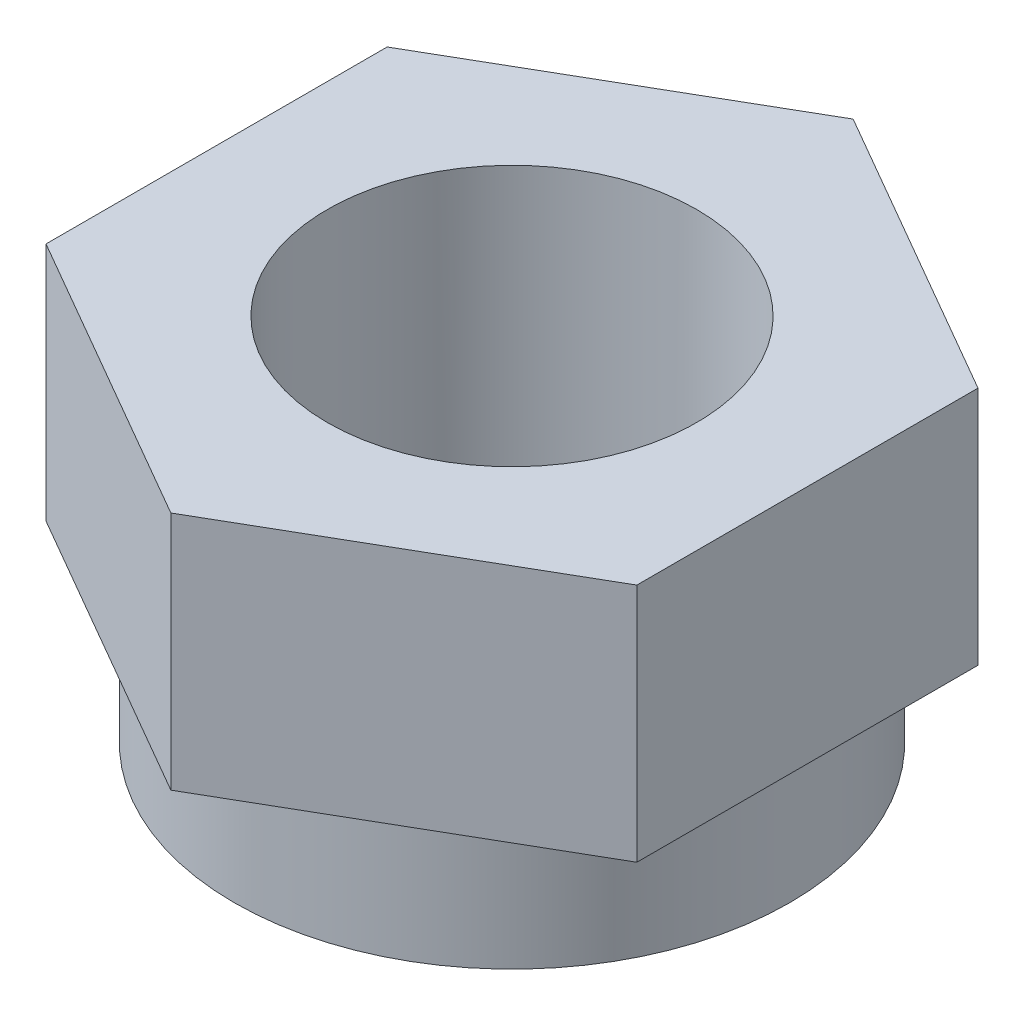
from build123d import *

# Parameters (mm, degrees)
BOSS_EXTRUDE1_DEPTH     = 3.25
SKETCH2_R               = 3.76
BOSS_EXTRUDE2_DEPTH     = 1.75
CUT_EXTRUDE1_DEPTH      = 8.895146188
CUT_EXTRUDE1_DEPTH_BACK = 8.895146188
SKETCH3_R               = 2.5


with BuildPart() as part:
    # Sketch1 → Boss-Extrude1 (new body)
    with BuildSketch(Plane(origin=(0, 0, 0), x_dir=(1, 0, 0), z_dir=(0, 1, 0))):
        Polygon((4, -2.309401077), (0, -4.618802154), (-4, -2.309401077), (-4, 2.309401077), (0, 4.618802154), (4, 2.309401077), align=None)
    extrude(amount=-BOSS_EXTRUDE1_DEPTH)

    # Sketch2 → Boss-Extrude2 (add)
    with BuildSketch(Plane(origin=(0, -3.25, 0), x_dir=(1, 0, 0), z_dir=(0, 1, 0))):
        Circle(SKETCH2_R)
    extrude(amount=-BOSS_EXTRUDE2_DEPTH)

    # Sketch3 → Cut-Extrude1 (cut, two sides: drawn at the far end of the back side and taken through both)
    with BuildSketch(Plane(origin=(0, 0, 0), x_dir=(1, 0, 0), z_dir=(0, 1, 0)).offset(-CUT_EXTRUDE1_DEPTH_BACK)):
        Circle(SKETCH3_R)
    extrude(amount=CUT_EXTRUDE1_DEPTH + CUT_EXTRUDE1_DEPTH_BACK, mode=Mode.SUBTRACT)


solid = part.part
